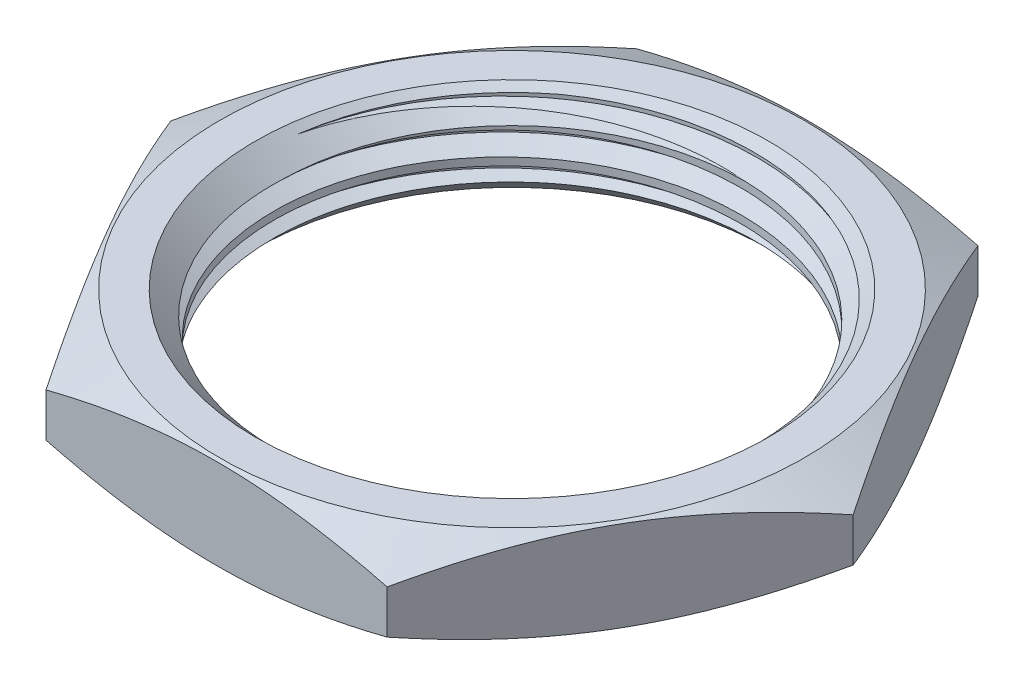
from build123d import *

# Parameters (mm, degrees)
SKETCH_1_R      = 7.5
EXTRUDE_1_DEPTH = 3
CHAMFER_1_SIZE  = 0.75
CHAMFER_3_SIZE  = 0.75
THREAD_1_PITCH  = 1


with BuildPart() as part:
    # Sketch 1 → Бобышка-Вытянуть1 (new body)
    with BuildSketch(Plane(origin=(0, 0, 0), x_dir=(1, 0, 0), z_dir=(0, 1, 0))):
        Polygon((10.969655115, 0), (5.484827557, 9.5), (-5.484827557, 9.5), (-10.969655115, 0), (-5.484827557, -9.5), (5.484827557, -9.5), align=None)
        with Locations(Location((0, 0, 0), (0, 0, 270))):
            Circle(SKETCH_1_R, mode=Mode.SUBTRACT)
    extrude(amount=EXTRUDE_1_DEPTH)

    # Фаска1
    chamfer_1_edges = [part.edges().sort_by_distance(p)[0] for p in [
        (0, 3, -7.5),
    ]]
    chamfer(chamfer_1_edges, length=CHAMFER_1_SIZE)

    # Фаска3
    chamfer_3_edges = [part.edges().sort_by_distance(p)[0] for p in [
        (0, 0, -7.5),
    ]]
    chamfer(chamfer_3_edges, length=CHAMFER_3_SIZE)

    # Эскиз5 → Вырез-Повернуть1 (revolve, cut)
    with BuildSketch(Plane.XY, mode=Mode.PRIVATE) as cut_revolve_1_sk:
        Polygon((-9.4, 3), (-10.969655115, 3), (-10.969655115, 2.2), align=None)
        Polygon((-10.969655115, 0), (-10.969655115, 0.8), (-9.4, 0), align=None)
    revolve(cut_revolve_1_sk.sketch.rotate(Axis((0, 0, 0), (0, 1, 0)), 270), axis=Axis((0, 0, 0), (0, 1, 0)), mode=Mode.SUBTRACT)

    # Резьба1: the profile of Sketch 1 2 profile screwed along a right-hand helix of 4.25 turns, 8 arcs to a turn; built about Z, then put on its axis
    thread_1_z = Axis((0, 0, 0), (0, 0, 1))
    thread_1_corners = [(7.4997, 0, -0.000173205), (8.041265875, 0, 0.312499999), (8.041265875, 0, 0.437499999), (7.4997, 0, 0.750173202)]
    with BuildLine(mode=Mode.PRIVATE) as thread_1_profile:
        Line(thread_1_corners[0], thread_1_corners[1])
        Line(thread_1_corners[1], thread_1_corners[2])
        Line(thread_1_corners[2], thread_1_corners[3])
        Line(thread_1_corners[3], thread_1_corners[0])
    thread_1_cap = Face(thread_1_profile.wire())
    thread_1_turn_angles = [0, 22.5, 45, 67.5, 90, 112.5, 135, 157.5, 180, 202.5, 225, 247.5, 270, 292.5, 315, 337.5, 360]
    thread_1_turn_weights = [1, 0.9238795325112867, 1, 0.9238795325112867, 1, 0.9238795325112867, 1, 0.9238795325112867, 1, 0.9238795325112867, 1, 0.9238795325112867, 1, 0.9238795325112867, 1, 0.9238795325112867, 1]
    thread_1_turn_rails = [Edge.make_bspline([Vector(p[0], p[1], 0).rotate(thread_1_z, thread_1_turn_angles[k]) / thread_1_turn_weights[k] + Vector(0, 0, p[2] + THREAD_1_PITCH * thread_1_turn_angles[k] / 360) for k in range(17)], [0, 0, 0, 1, 1, 2, 2, 3, 3, 4, 4, 5, 5, 6, 6, 7, 7, 8, 8, 8], 2, thread_1_turn_weights) for p in thread_1_corners]
    thread_1_turn_sides = [Face.make_surface_from_curves(thread_1_turn_rails[p[0]], thread_1_turn_rails[p[1]]) for p in [(0, 1), (1, 2), (2, 3), (3, 0)]]
    thread_1_last_angles = [1440, 1462.5, 1485, 1507.5, 1530]
    thread_1_last_weights = [1, 0.9238795325112867, 1, 0.9238795325112822, 1]
    thread_1_last_rails = [Edge.make_bspline([Vector(p[0], p[1], 0).rotate(thread_1_z, thread_1_last_angles[k]) / thread_1_last_weights[k] + Vector(0, 0, p[2] + THREAD_1_PITCH * thread_1_last_angles[k] / 360) for k in range(5)], [0, 0, 0, 1, 1, 2, 2, 2], 2, thread_1_last_weights) for p in thread_1_corners]
    thread_1_last_sides = [Face.make_surface_from_curves(thread_1_last_rails[p[0]], thread_1_last_rails[p[1]]) for p in [(0, 1), (1, 2), (2, 3), (3, 0)]]
    thread_1 = Plane(origin=(0, 4.25, 0), x_dir=(-1, 0, 0), z_dir=(0, -1, 0)) * Solid(Shell([*[p.moved(Location((0, 0, THREAD_1_PITCH * i))) for i in range(4) for p in thread_1_turn_sides], *thread_1_last_sides, thread_1_cap, thread_1_cap.rotate(thread_1_z, 1530).moved(Location((0, 0, THREAD_1_PITCH * 1530 / 360)))]))
    add(thread_1, mode=Mode.SUBTRACT)


solid = part.part
